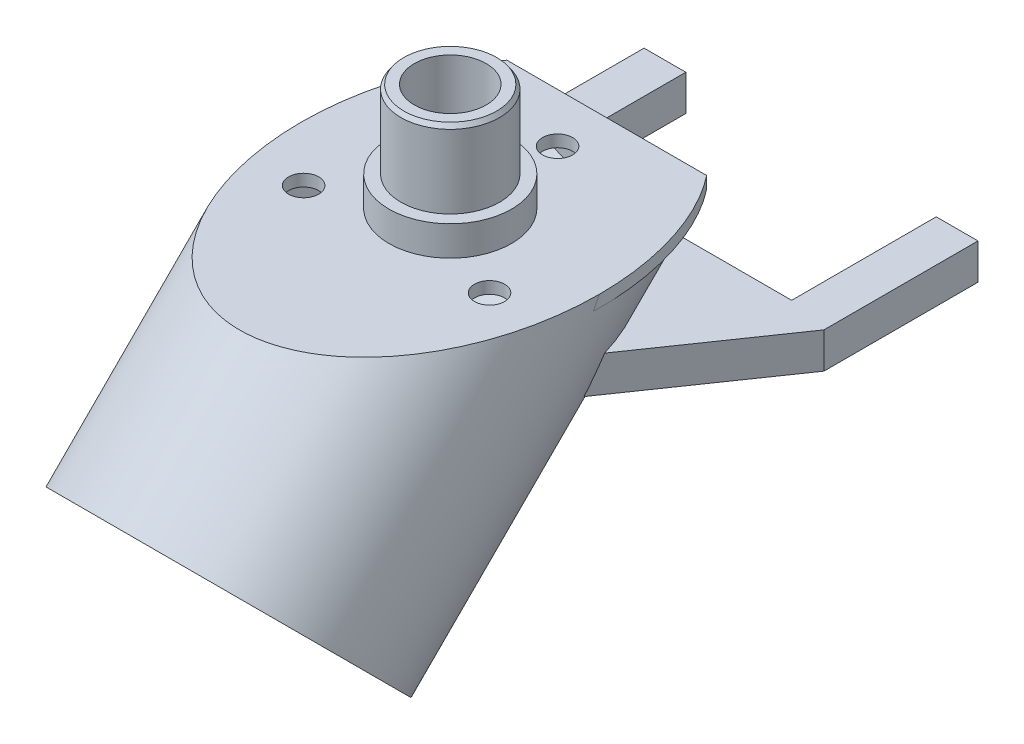
from build123d import *

# Parameters (mm, degrees)
SKETCH1_R                 = 10.275
SKETCH1_R_2               = 8.275
BOSS_EXTRUDE3_DEPTH       = 5
SKETCH1_6_R               = 8.275
SKETCH1_6_R_2             = 6.025
BOSS_EXTRUDE4_DEPTH       = 18
BOSS_EXTRUDE7_DEPTH       = 40
BOSS_EXTRUDE7_DEPTH_BACK  = 70
SKETCH4_R                 = 25
SKETCH4_R_2               = 23
SKETCH7_W                 = 197.712308018
SKETCH7_H                 = 113.854833504
CUT_EXTRUDE4_DEPTH        = 64
BOSS_EXTRUDE9_START       = -2
SKETCH9_RX                = 35.355339059
SKETCH9_RY                = 25
SKETCH9_R                 = 6.025
BOSS_EXTRUDE9_DEPTH       = 2
BOSS_EXTRUDE12_DEPTH      = 2
BOSS_EXTRUDE12_DEPTH_BACK = 4
SKETCH22_W                = 69.752550136
SKETCH22_H                = 19.780641822
CUT_EXTRUDE5_DEPTH        = 10
BOSS_EXTRUDE13_START      = -2
BOSS_EXTRUDE13_DEPTH      = 2
CUT_EXTRUDE6_REACH        = 111.4
SKETCH21_R                = 2.525
CUT_EXTRUDE14_START       = -80
CUT_EXTRUDE14_DEPTH       = 80
CUT_EXTRUDE21_START       = -86
CUT_EXTRUDE21_DEPTH       = 86
SKETCH28_R                = 28.746438964
CUT_EXTRUDE22_DEPTH       = 25
CHAMFER1_SIZE             = 0.7
CHAMFER1_SIZE2            = 0.490145277


with BuildPart() as part:
    # Sketch1 → Boss-Extrude3 (new body)
    with BuildSketch(Plane(origin=(0, 0, 0), x_dir=(1, 0, 0), z_dir=(0, 1, 0))):
        with Locations(Location((0, 0, 0), (0, 0, 270))):
            Circle(SKETCH1_R)
        with Locations(Location((0, 0, 0), (0, 0, 270))):
            Circle(SKETCH1_R_2, mode=Mode.SUBTRACT)
    extrude(amount=BOSS_EXTRUDE3_DEPTH)

    # Sketch1<6> → Boss-Extrude4 (add)
    with BuildSketch(Plane(origin=(0, 0, 0), x_dir=(1, 0, 0), z_dir=(0, 1, 0))):
        with Locations(Location((0, 0, 0), (0, 0, 270))):
            Circle(SKETCH1_6_R)
        with Locations(Location((0, 0, 0), (0, 0, 270))):
            Circle(SKETCH1_6_R_2, mode=Mode.SUBTRACT)
    extrude(amount=BOSS_EXTRUDE4_DEPTH)



with BuildPart() as body_2:
    # Sketch4 → Boss-Extrude7 (new, two sides: drawn at the far end of the back side and taken through both)
    with BuildSketch(Plane(origin=(0, -5.365491749, 5.365491749), x_dir=(-1, 0, 0), z_dir=(0, 0.7071067811865458, -0.7071067811865492)).offset(-BOSS_EXTRUDE7_DEPTH_BACK)):
        with Locations(Location((0, 0, 0), (0, 0, 90))):
            Circle(SKETCH4_R)
        with Locations(Location((0, 0, 0), (0, 0, 90))):
            Circle(SKETCH4_R_2, mode=Mode.SUBTRACT)
    extrude(amount=BOSS_EXTRUDE7_DEPTH + BOSS_EXTRUDE7_DEPTH_BACK)

    # Sketch7 → Cut-Extrude4 (cut)
    with BuildSketch(Plane(origin=(0, 0, 0), x_dir=(1, 0, 0), z_dir=(0, 1, 0))):
        Rectangle(SKETCH7_W, SKETCH7_H)
    extrude(amount=CUT_EXTRUDE4_DEPTH, mode=Mode.SUBTRACT)


with BuildPart() as part_1:
    add(part.part)

    add(body_2.part)  # Boss-Extrude9 merges body 2
    # Sketch9 → Boss-Extrude9 (add)
    with BuildSketch(Plane(origin=(0, 0, 0), x_dir=(1, 0, 0), z_dir=(0, 1, 0)).offset(BOSS_EXTRUDE9_START)):
        with Locations(Location((0, 0), (0, 0, -90))):
            Ellipse(SKETCH9_RX, SKETCH9_RY)
        with Locations(Location((0, 0, 0), (0, 0, 270))):
            Circle(SKETCH9_R, mode=Mode.SUBTRACT)
    extrude(amount=BOSS_EXTRUDE9_DEPTH)

    # Sketch15 → Boss-Extrude12 (add, two sides: drawn at the far end of the back side and taken through both)
    with BuildSketch(Plane(origin=(0, -13, 0), x_dir=(1, 0, 0), z_dir=(0, 1, 0)).offset(-BOSS_EXTRUDE12_DEPTH_BACK)):
        Polygon((-18, 50.5), (-18, 5.077623205), (-11, 12.425207431), (0.436295729, 16.20866498), (9.681434559, 13.33514052), (16.664877802, 7.136081647), (20.985766733, 0), (38, 24.667240496), (38, 50.5), (31, 50.5), (31, 26.250403727), (-11, 26.250403727), (-11, 50.5), align=None)
    extrude(amount=BOSS_EXTRUDE12_DEPTH + BOSS_EXTRUDE12_DEPTH_BACK)

    # Sketch22 → Cut-Extrude5 (cut)
    with BuildSketch(Plane.XY.offset(-26.250403727)):
        Rectangle(SKETCH22_W, SKETCH22_H)
    extrude(amount=-CUT_EXTRUDE5_DEPTH, mode=Mode.SUBTRACT)

    # Boss-Extrude13: read off the stored shape, not the designer's step
    # Boss-Extrude13 outline → Boss-Extrude13 (add)
    with BuildSketch(Plane(origin=(0, 0, -26.250403727), x_dir=(-1, 0, 0), z_dir=(0, 0, -1)).offset(BOSS_EXTRUDE13_START)):
        with BuildLine():
            add(Edge.make_bspline(
                [(13.581537177, -2), (0, -16.053738297), (-13.581537177, -2)],
                knots=[2.5099124, 2.5099124, 2.5099124, 3.773272907, 3.773272907, 3.773272907], degree=2, weights=[1, 0.807036456, 1]))
            Line((13.581537177, -2), (-13.581537177, -2))
        make_face()
    extrude(amount=BOSS_EXTRUDE13_DEPTH)

    # Sketch21 → Cut-Extrude6 (cut, up to next)
    with BuildSketch(Plane(origin=(0, 0, 0), x_dir=(1, 0, 0), z_dir=(0, 1, 0)), mode=Mode.PRIVATE) as cut_extrude6_sk1:
        with Locations(Location((0, 18, 0), (0, 0, 270))):
            Circle(SKETCH21_R)
    cut_extrude6_tool1 = extrude(cut_extrude6_sk1.sketch, amount=-CUT_EXTRUDE6_REACH, mode=Mode.PRIVATE) & part_1.part
    # Sketch21 → Cut-Extrude6 (cut, up to next)
    with BuildSketch(Plane(origin=(0, 0, 0), x_dir=(1, 0, 0), z_dir=(0, 1, 0)), mode=Mode.PRIVATE) as cut_extrude6_sk2:
        with Locations(Location((15.588457268, -9, 0), (0, 0, 270))):
            Circle(SKETCH21_R)
    cut_extrude6_tool2 = extrude(cut_extrude6_sk2.sketch, amount=-CUT_EXTRUDE6_REACH, mode=Mode.PRIVATE) & part_1.part
    # Sketch21 → Cut-Extrude6 (cut, up to next)
    with BuildSketch(Plane(origin=(0, 0, 0), x_dir=(1, 0, 0), z_dir=(0, 1, 0)), mode=Mode.PRIVATE) as cut_extrude6_sk3:
        with Locations(Location((-15.588457268, -9, 0), (0, 0, 270))):
            Circle(SKETCH21_R)
    cut_extrude6_tool3 = extrude(cut_extrude6_sk3.sketch, amount=-CUT_EXTRUDE6_REACH, mode=Mode.PRIVATE) & part_1.part
    add(cut_extrude6_tool1.solids().sort_by_distance((0, 0, -18))[0], mode=Mode.SUBTRACT)
    add(cut_extrude6_tool2.solids().sort_by_distance((15.588457, 0, 9))[0], mode=Mode.SUBTRACT)
    add(cut_extrude6_tool3.solids().sort_by_distance((-15.588457, 0, 9))[0], mode=Mode.SUBTRACT)

    # Sketch25 → Cut-Extrude14 (cut)
    with BuildSketch(Plane(origin=(0, -54.862966432, 54.862966432), x_dir=(1, 0, 0), z_dir=(0, -0.7071067811865458, 0.7071067811865492)).offset(CUT_EXTRUDE14_START)):
        with BuildLine():
            Line((-18.997239916, -12.965526429), (-18.318994403, -10.280413374))
            Line((-18.318994403, -10.280413374), (-10.404229656, -15.136075873))
            Line((-10.404229656, -15.136075873), (-2.155134235, -17.219754227))
            Line((-2.155134235, -17.219754227), (4.378324516, -17.219754227))
            Line((4.378324516, -17.219754227), (10.005758959, -15.720266669))
            Line((10.005758959, -15.720266669), (15.570666352, -12.156224855))
            Line((15.570666352, -12.156224855), (20.908140469, -7.71958569))
            Line((20.908140469, -7.71958569), (21.57633395, -7.966292318))
            ThreePointArc((21.57633395, -7.966292318), (2.812653006, -22.827373547), (-18.997239916, -12.965526429))
        make_face()
    extrude(amount=CUT_EXTRUDE14_DEPTH, mode=Mode.SUBTRACT)

    # Sketch27 → Cut-Extrude21 (cut)
    with BuildSketch(Plane(origin=(0, -54.862966432, 54.862966432), x_dir=(1, 0, 0), z_dir=(0, -0.7071067811865458, 0.7071067811865492)).offset(CUT_EXTRUDE21_START)):
        with BuildLine():
            Line((-14.900346348, -17.520835559), (14.900346348, -17.520835559))
            ThreePointArc((14.900346348, -17.520835559), (0, -23), (-14.900346348, -17.520835559))
        make_face()
    extrude(amount=CUT_EXTRUDE21_DEPTH, mode=Mode.SUBTRACT)

    # Sketch28 → Cut-Extrude22 (cut)
    with BuildSketch(Plane(origin=(0, -54.862966432, 54.862966432), x_dir=(1, 0, 0), z_dir=(0, -0.7071067811865458, 0.7071067811865492))):
        Circle(SKETCH28_R)
    extrude(amount=-CUT_EXTRUDE22_DEPTH, mode=Mode.SUBTRACT)

    # Chamfer1
    chamfer1_edges = [part_1.edges().sort_by_distance(p)[0] for p in [
        (0, 18, -8.275),
    ]]
    chamfer1_side = [part_1.faces().sort_by_distance(p)[0] for p in [
        (0, 11.5, -8.275),
    ]]
    chamfer(chamfer1_edges, length=CHAMFER1_SIZE, length2=CHAMFER1_SIZE2, reference=chamfer1_side[0])


solid = part_1.part
